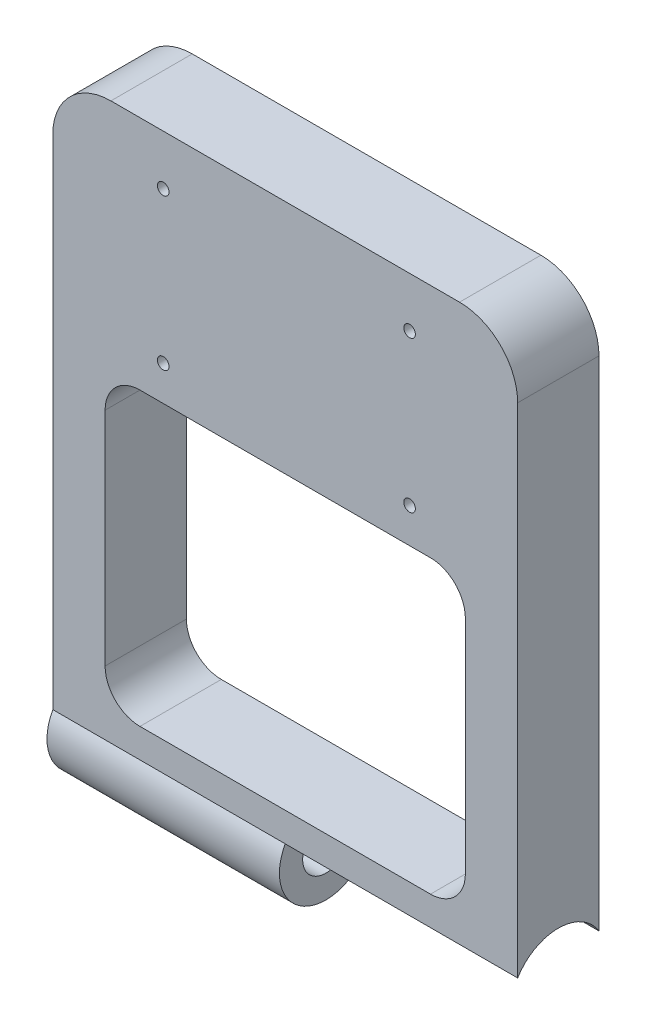
from build123d import *

# Parameters (mm, degrees)
SKETCH1_W                = 40
SKETCH1_H                = 50
BOSS_EXTRUDE1_DEPTH      = 7
SKETCH2_R                = 4.1
CUT_EXTRUDE1_DEPTH       = 20
BOSS_EXTRUDE2_DEPTH      = 11
BOSS_EXTRUDE2_DEPTH_BACK = 9
SKETCH3_R                = 4
SKETCH3_R_2              = 2
FILLET1_R                = 5
SKETCH4_R                = 0.5
SKETCH4_W                = 31
SKETCH4_H                = 25.064584349
CUT_EXTRUDE2_DEPTH       = 45.095541639
FILLET2_R                = 3
SKETCH5_R                = 2
CUT_EXTRUDE3_DEPTH       = 56.229329833


with BuildPart() as part:
    # Sketch1 → Boss-Extrude1 (new body)
    with BuildSketch(Plane.XY):
        with Locations((-2.229213179, -8.535620053)):
            Rectangle(SKETCH1_W, SKETCH1_H)
    extrude(amount=BOSS_EXTRUDE1_DEPTH)

    # Sketch2 → Cut-Extrude1 (cut)
    with BuildSketch(Plane(origin=(17.770786821, 0, 0), x_dir=(0, 0, -1), z_dir=(1, 0, 0))):
        with Locations((-3.5, -33.535620053)):
            Circle(SKETCH2_R)
    extrude(amount=-CUT_EXTRUDE1_DEPTH, mode=Mode.SUBTRACT)

    # Sketch3 → Boss-Extrude2 (add, two sides: drawn at the far end of the back side and taken through both)
    with BuildSketch(Plane(origin=(-13.229213179, 0, 0), x_dir=(0, 0, -1), z_dir=(1, 0, 0)).offset(-BOSS_EXTRUDE2_DEPTH_BACK)):
        with Locations((-3.5, -33.336696075)):
            Circle(SKETCH3_R)
        with Locations((-3.5, -33.336696075)):
            Circle(SKETCH3_R_2, mode=Mode.SUBTRACT)
    extrude(amount=BOSS_EXTRUDE2_DEPTH + BOSS_EXTRUDE2_DEPTH_BACK)

    # Fillet1
    fillet1_edges = [part.edges().sort_by_distance(p)[0] for p in [
        (-22.229213179, 16.464379947, 3.5),
        (17.770786821, 16.464379947, 3.5),
    ]]
    fillet(fillet1_edges, radius=FILLET1_R)

    # Sketch4 → Cut-Extrude2 (cut, through all)
    with BuildSketch(Plane(origin=(0, 0, 0), x_dir=(-1, 0, 0), z_dir=(0, 0, -1))):
        with Locations((-8.470786821, 12.164379947)):
            Circle(SKETCH4_R)
        with Locations((12.729213179, 12.164379947)):
            Circle(SKETCH4_R)
        with Locations((12.729213179, -0.835620053)):
            Circle(SKETCH4_R)
        with Locations((-8.470786821, -0.835620053)):
            Circle(SKETCH4_R)
        with Locations((2.229213179, -16.367912228)):
            Rectangle(SKETCH4_W, SKETCH4_H)
    extrude(amount=-CUT_EXTRUDE2_DEPTH, mode=Mode.SUBTRACT)

    # Fillet2
    fillet2_edges = [part.edges().sort_by_distance(p)[0] for p in [
        (13.270786821, -3.835620053, 3.5),
        (13.270786821, -28.900204402, 3.5),
        (-17.729213179, -28.900204402, 3.5),
        (-17.729213179, -3.835620053, 3.5),
    ]]
    fillet(fillet2_edges, radius=FILLET2_R)

    # Sketch5 → Cut-Extrude3 (cut, through all)
    with BuildSketch(Plane.ZY.offset(22.229213179)):
        with Locations((3.5, -33.336696075)):
            Circle(SKETCH5_R)
    extrude(amount=-CUT_EXTRUDE3_DEPTH, mode=Mode.SUBTRACT)


solid = part.part
